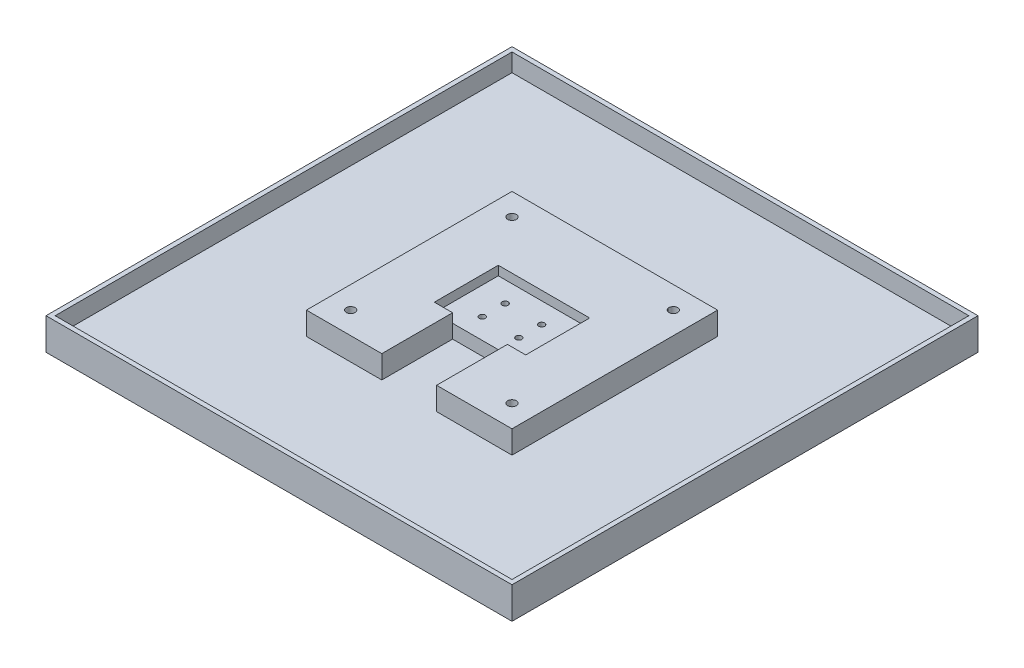
from build123d import *

# Parameters (mm, degrees)
SKETCH1_W           = 259.08
SKETCH1_H           = 259.08
SKETCH1_W_2         = 254
SKETCH1_H_2         = 254
BOSS_EXTRUDE1_DEPTH = 10
SKETCH1_2_W         = 259.08
SKETCH1_2_H         = 259.08
BOSS_EXTRUDE2_DEPTH = 7.62
SKETCH2_R           = 2.413
BOSS_EXTRUDE3_DEPTH = 12.7
SKETCH3_W           = 50.8
SKETCH3_H           = 35.56
SKETCH3_R           = 1.651
SKETCH3_R_2         = 1.681286521
BOSS_EXTRUDE4_DEPTH = 7.62


with BuildPart() as part:
    # Sketch1 → Boss-Extrude1 (new body)
    with BuildSketch(Plane(origin=(0, 0, 0), x_dir=(1, 0, 0), z_dir=(0, 1, 0))):
        Rectangle(SKETCH1_W, SKETCH1_H)
        Rectangle(SKETCH1_W_2, SKETCH1_H_2, mode=Mode.SUBTRACT)
    extrude(amount=BOSS_EXTRUDE1_DEPTH)

    # Sketch1<2> → Boss-Extrude2 (add)
    with BuildSketch(Plane(origin=(0, 0, 0), x_dir=(1, 0, 0), z_dir=(0, 1, 0))):
        Rectangle(SKETCH1_2_W, SKETCH1_2_H)
    extrude(amount=-BOSS_EXTRUDE2_DEPTH)

    # Sketch2 → Boss-Extrude3 (add)
    with BuildSketch(Plane(origin=(0, 0, 0), x_dir=(1, 0, 0), z_dir=(0, 1, 0))):
        Polygon((15.24, -17.78), (25.4, -17.78), (25.4, 17.78), (-25.4, 17.78), (-25.4, -17.78), (-15.24, -17.78), (-15.24, -57.15), (-57.15, -57.15), (-57.15, 57.15), (57.15, 57.15), (57.15, -57.15), (15.24, -57.15), align=None)
        with Locations((44.845, 44.845)):
            Circle(SKETCH2_R, mode=Mode.SUBTRACT)
        with Locations((44.845, -44.845)):
            Circle(SKETCH2_R, mode=Mode.SUBTRACT)
        with Locations((-44.845, -44.845)):
            Circle(SKETCH2_R, mode=Mode.SUBTRACT)
        with Locations((-44.845, 44.845)):
            Circle(SKETCH2_R, mode=Mode.SUBTRACT)
    extrude(amount=BOSS_EXTRUDE3_DEPTH)

    # Sketch3 → Boss-Extrude4 (add)
    with BuildSketch(Plane(origin=(0, 0, 0), x_dir=(1, 0, 0), z_dir=(0, 1, 0))):
        Rectangle(SKETCH3_W, SKETCH3_H)
        with Locations((10.16, 6.35)):
            Circle(SKETCH3_R, mode=Mode.SUBTRACT)
        with Locations((10.16, -6.35)):
            Circle(SKETCH3_R, mode=Mode.SUBTRACT)
        with Locations((-10.16, -6.35)):
            Circle(SKETCH3_R, mode=Mode.SUBTRACT)
        with Locations((-10.16, 6.35)):
            Circle(SKETCH3_R_2, mode=Mode.SUBTRACT)
    extrude(amount=BOSS_EXTRUDE4_DEPTH)


solid = part.part
